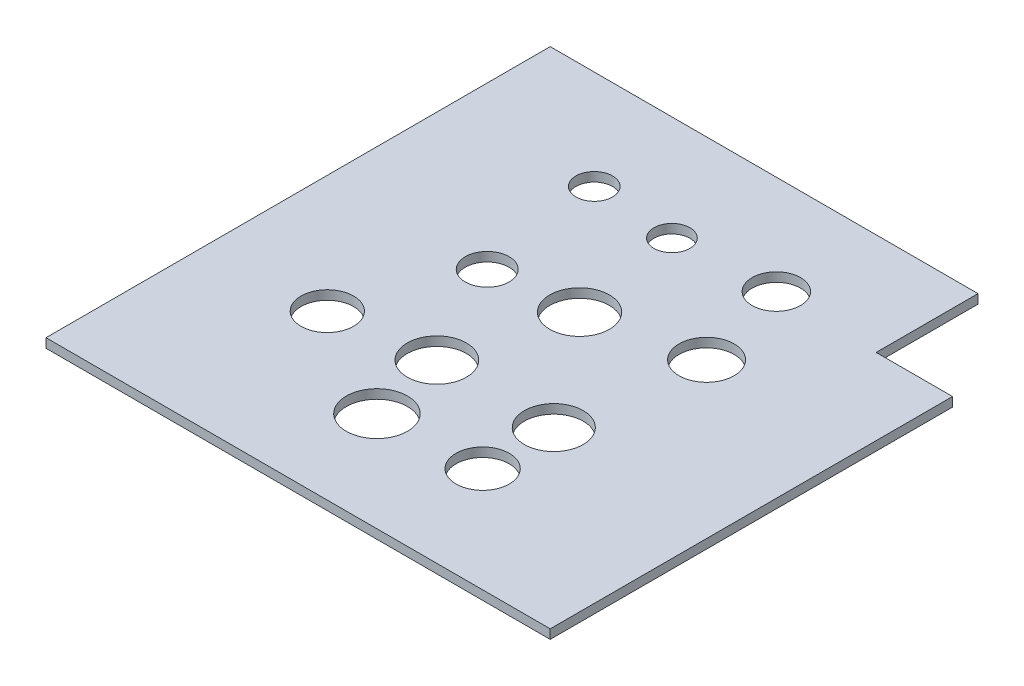
from build123d import *

# Parameters (mm, degrees)
SKETCH_1_W          = 99
SKETCH_1_H          = 99
EXTRUDE_1_DEPTH     = 1.8
SKETCH_2_R          = 3.588068341
SKETCH_2_R_2        = 3.525742695
SKETCH_2_R_3        = 4.755209388
SKETCH_2_R_4        = 4.305758286
SKETCH_2_R_5        = 5.854240645
SKETCH_2_R_6        = 5.416180716
SKETCH_2_R_7        = 5.1593404
SKETCH_2_R_8        = 5.817993504
SKETCH_2_R_9        = 5.774849029
SKETCH_2_R_10       = 6.00644775
SKETCH_2_R_11       = 5.227322997
CUT_EXTRUDE_1_DEPTH = 141.018713035
SKETCH_3_W          = 15
SKETCH_3_H          = 20
CUT_EXTRUDE_2_DEPTH = 141.018713035


with BuildPart() as part:
    # 草图1 → 凸台-拉伸1 (new body)
    with BuildSketch(Plane(origin=(0, 0, 0), x_dir=(1, 0, 0), z_dir=(0, 1, 0))):
        with Locations((49.5, 49.5)):
            Rectangle(SKETCH_1_W, SKETCH_1_H)
    extrude(amount=EXTRUDE_1_DEPTH)

    # 草图2 → 切除-拉伸1 (cut, through all)
    with BuildSketch(Plane(origin=(0, 1.8, 0), x_dir=(1, 0, 0), z_dir=(0, 1, 0))):
        with Locations((28.09973525, 79.550072359)):
            Circle(SKETCH_2_R)
        with Locations((44.502333382, 78.396764678)):
            Circle(SKETCH_2_R_2)
        with Locations((63.852273366, 79.550072359)):
            Circle(SKETCH_2_R_3)
        with Locations((31.687803591, 54.946175161)):
            Circle(SKETCH_2_R_4)
        with Locations((48.028076077, 56.740209332)):
            Circle(SKETCH_2_R_5)
        with Locations((68.607482754, 61.097149461)):
            Circle(SKETCH_2_R_6)
        with Locations((23.102068631, 32.136312134)):
            Circle(SKETCH_2_R_7)
        with Locations((42.173835432, 34.571072794)):
            Circle(SKETCH_2_R_8)
        with Locations((65.133726345, 34.571072794)):
            Circle(SKETCH_2_R_9)
        with Locations((45.399350467, 19.578072939)):
            Circle(SKETCH_2_R_10)
        with Locations((65.133726345, 20.603235322)):
            Circle(SKETCH_2_R_11)
    extrude(amount=-CUT_EXTRUDE_1_DEPTH, mode=Mode.SUBTRACT)

    # 草图3 → 切除-拉伸2 (cut, through all)
    with BuildSketch(Plane(origin=(0, 1.8, 0), x_dir=(1, 0, 0), z_dir=(0, 1, 0))):
        with Locations((91.5, 89)):
            Rectangle(SKETCH_3_W, SKETCH_3_H)
    extrude(amount=-CUT_EXTRUDE_2_DEPTH, mode=Mode.SUBTRACT)


solid = part.part
